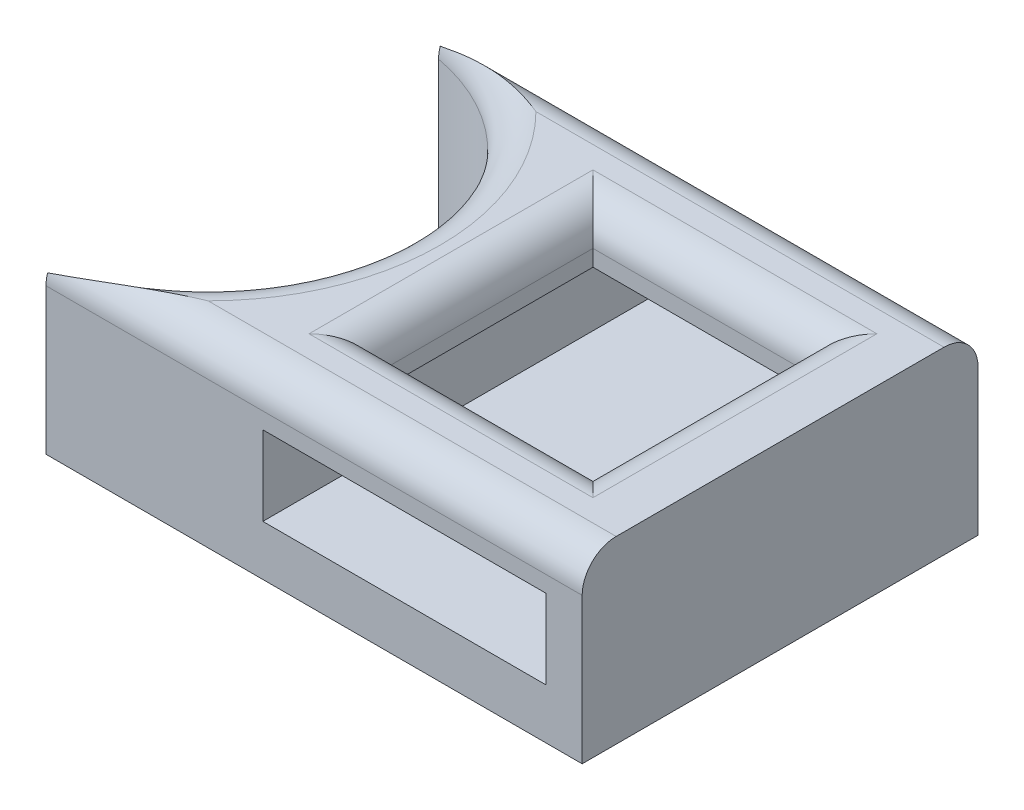
from build123d import *

# Parameters (mm, degrees)
BOSS_EXTRUDE1_DEPTH = 15.875
SKETCH5_W           = 3.175
SKETCH5_H           = 15.875
CUT_EXTRUDE1_DEPTH  = 3.175
SKETCH6_W           = 3.175
SKETCH6_H           = 15.875
CUT_EXTRUDE2_DEPTH  = 3.175
SKETCH7_W           = 19.05
SKETCH7_H           = 19.05
CUT_EXTRUDE4_DEPTH  = 10
SKETCH8_W           = 25
SKETCH8_H           = 7
CUT_EXTRUDE5_DEPTH  = 63.813266363
FILLET3_R           = 3
SKETCH2_W           = 25.4
SKETCH2_H           = 3.175
CUT_EXTRUDE6_DEPTH  = 4.175
SKETCH3_W           = 25.4
SKETCH3_H           = 3.175
CUT_EXTRUDE7_DEPTH  = 4.175
FILLET4_R           = 3


with BuildPart() as part:
    # Sketch1 → Boss-Extrude1 (new body)
    with BuildSketch(Plane(origin=(0, 0, 0), x_dir=(1, 0, 0), z_dir=(0, 1, 0))):
        with BuildLine():
            Line((-52.911658323, 34.190937018), (-2.431658323, 34.190937018))
            Line((-2.431658323, 34.190937018), (-2.431658323, -0.734062982))
            Line((-2.431658323, -0.734062982), (-52.911658323, -0.734062982))
            ThreePointArc((-52.911658323, -0.734062982), (-35.449158323, 16.728437018), (-52.911658323, 34.190937018))
        make_face()
    extrude(amount=BOSS_EXTRUDE1_DEPTH)

    # Sketch5 → Cut-Extrude1 (cut)
    with BuildSketch(Plane(origin=(0, 0, -34.190937018), x_dir=(-1, 0, 0), z_dir=(0, 0, -1))):
        with Locations((51.324158323, 7.9375)):
            Rectangle(SKETCH5_W, SKETCH5_H)
    extrude(amount=-CUT_EXTRUDE1_DEPTH, mode=Mode.SUBTRACT)

    # Sketch6 → Cut-Extrude2 (cut)
    with BuildSketch(Plane.XY.offset(0.734062982)):
        with Locations((-51.324158323, 7.9375)):
            Rectangle(SKETCH6_W, SKETCH6_H)
    extrude(amount=-CUT_EXTRUDE2_DEPTH, mode=Mode.SUBTRACT)

    # Sketch7 → Cut-Extrude4 (cut)
    with BuildSketch(Plane(origin=(0, 15.875, 0), x_dir=(1, 0, 0), z_dir=(0, 1, 0))):
        with Locations((-18.940408323, 16.728437018)):
            Rectangle(SKETCH7_W, SKETCH7_H)
    extrude(amount=-CUT_EXTRUDE4_DEPTH, mode=Mode.SUBTRACT)

    # Sketch8 → Cut-Extrude5 (cut, through all)
    with BuildSketch(Plane(origin=(0, 0, -34.190937018), x_dir=(-1, 0, 0), z_dir=(0, 0, -1))):
        with Locations((18.106658323, 7.9375)):
            Rectangle(SKETCH8_W, SKETCH8_H)
    extrude(amount=-CUT_EXTRUDE5_DEPTH, mode=Mode.SUBTRACT)

    # Fillet3
    # the kernel refuses this fillet: 3 mm, written as the material it takes off along each edge
    with BuildSketch(Plane(origin=(-57.236658323, 15.875, -34.190937018), x_dir=(0, 0, 1), z_dir=(1, 0, 0)), Plane(origin=(5.068341677, 15.875, 0.734062982), x_dir=(0, 0, -1), z_dir=(-1, 0, 0))) as fillet3_piece_1:
        with BuildLine():
            CenterArc((FILLET3_R, FILLET3_R), FILLET3_R, 180, 90)
            Line((0, FILLET3_R), (0, 0))
            Line((0, 0), (FILLET3_R, 0))
        make_face()
    extrude(amount=62.305, mode=Mode.SUBTRACT)
    with BuildSketch(Plane(origin=(-52.911658323, 15.875, -16.728437018), x_dir=(-0.24468593558499258, 0, 0.969602389088897), z_dir=(-0.969602389088897, 0, -0.24468593558499258))) as fillet3_piece_2:
        with BuildLine():
            CenterArc((17.4625 + FILLET3_R, -FILLET3_R), FILLET3_R, 90, 90)
            Line((17.4625 + FILLET3_R, 0), (17.4625, 0))
            Line((17.4625, 0), (17.4625, -FILLET3_R))
        make_face()
    revolve(axis=Axis((-52.911658323, 15.875, -16.728437018), (0, 1, 0)), revolution_arc=208.326548528, mode=Mode.SUBTRACT)

    # Sketch2 → Cut-Extrude6 (cut)
    with BuildSketch(Plane(origin=(0, 0, 0), x_dir=(-1, 0, 0), z_dir=(0, -1, 0))):
        with Locations((18.306658323, 26.253437018)):
            Rectangle(SKETCH2_W, SKETCH2_H)
    extrude(amount=-CUT_EXTRUDE6_DEPTH, mode=Mode.SUBTRACT)

    # Sketch3 → Cut-Extrude7 (cut)
    with BuildSketch(Plane(origin=(0, 0, 0), x_dir=(-1, 0, 0), z_dir=(0, -1, 0))):
        with Locations((18.306658323, 7.203437018)):
            Rectangle(SKETCH3_W, SKETCH3_H)
    extrude(amount=-CUT_EXTRUDE7_DEPTH, mode=Mode.SUBTRACT)

    # Fillet4
    fillet4_edges = [part.edges().sort_by_distance(p)[0] for p in [
        (-9.415408323, 15.875, -16.728437018),
        (-18.940408323, 15.875, -26.253437018),
        (-28.465408323, 15.875, -16.728437018),
        (-18.940408323, 15.875, -7.203437018),
    ]]
    fillet(fillet4_edges, radius=FILLET4_R)


solid = part.part
